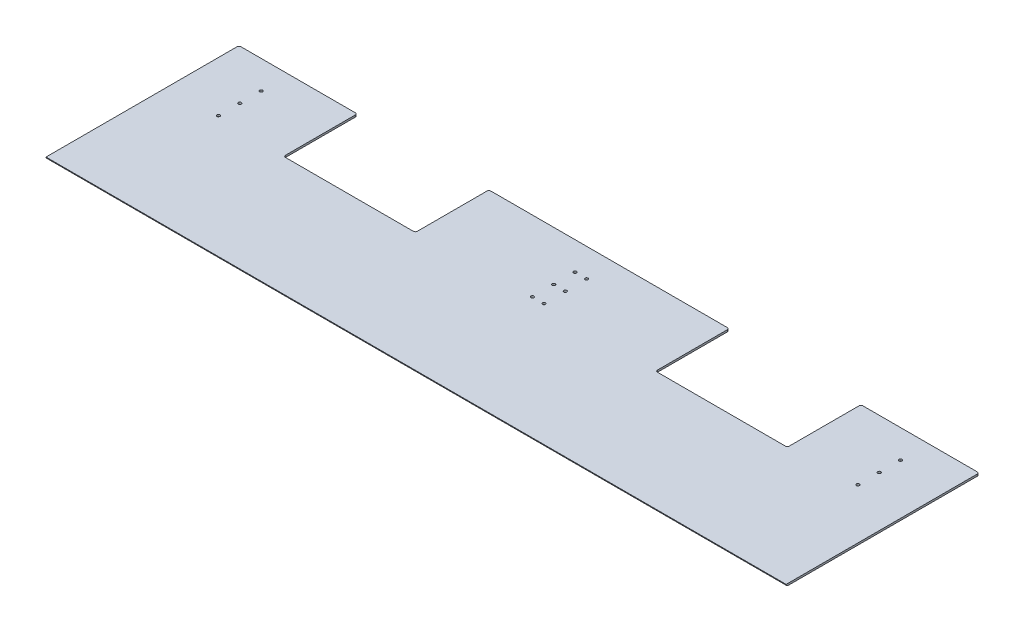
from build123d import *

# Parameters (mm, degrees)
SKETCH1_W                    = 1212.85
SKETCH1_H                    = 316.23
BOSS_EXTRUDE1_DEPTH          = 3.175
FILLET1_R                    = 3.175
SKETCH4_W                    = 215.9
SKETCH4_H                    = 120.65
CUT_EXTRUDE1_DEPTH           = 1254.402016922
FILLET2_R                    = 3.175
F_10_0_1935_DIAMETER_HOLE1_D = 4.9149


with BuildPart() as part:
    # Sketch1 → Boss-Extrude1 (new body)
    with BuildSketch(Plane(origin=(0, 0, 0), x_dir=(1, 0, 0), z_dir=(0, 1, 0))):
        with Locations((606.425, 158.115)):
            Rectangle(SKETCH1_W, SKETCH1_H)
    extrude(amount=BOSS_EXTRUDE1_DEPTH)

    # Fillet1
    fillet1_edges = [part.edges().sort_by_distance(p)[0] for p in [
        (606.425, 0, 0),
    ]]
    fillet(fillet1_edges, radius=FILLET1_R - 0.0001)  # a hair under: the kernel refuses the full size

    # Sketch4 → Cut-Extrude1 (cut, through all)
    with BuildSketch(Plane(origin=(0, 3.175, 0), x_dir=(1, 0, 0), z_dir=(0, 1, 0))):
        with Locations((301.625, 255.905)):
            Rectangle(SKETCH4_W, SKETCH4_H)
        with Locations((911.225, 255.905)):
            Rectangle(SKETCH4_W, SKETCH4_H)
    extrude(amount=-CUT_EXTRUDE1_DEPTH, mode=Mode.SUBTRACT)

    # Fillet2
    fillet2_edges = [part.edges().sort_by_distance(p)[0] for p in [
        (193.675, 1.5875, -195.58),
        (193.675, 1.5875, -316.23),
        (409.575, 1.5875, -316.23),
        (409.575, 1.5875, -195.58),
        (803.275, 1.5875, -316.23),
        (1019.175, 1.5875, -316.23),
        (1019.175, 1.5875, -195.58),
        (803.275, 1.5875, -195.58),
        (0, 1.5875, -316.23),
        (1212.85, 1.5875, -316.23),
    ]]
    fillet(fillet2_edges, radius=FILLET2_R)

    # #10 (0.1935) Diameter Hole1 (through all)
    with Locations(Plane(origin=(0, 3.175, 0), x_dir=(1, 0, 0), z_dir=(0, 1, 0))):
        with Locations((82.55, 200.1012), (82.55, 235.0262), (82.55, 269.9512), (596.9, 200.1012), (596.9, 235.0262), (596.9, 269.9512), (615.95, 269.9512), (615.95, 235.0262), (615.95, 200.1012), (1130.3, 269.9512), (1130.3, 235.0262), (1130.3, 200.1012)):
            Hole(F_10_0_1935_DIAMETER_HOLE1_D / 2)


solid = part.part
